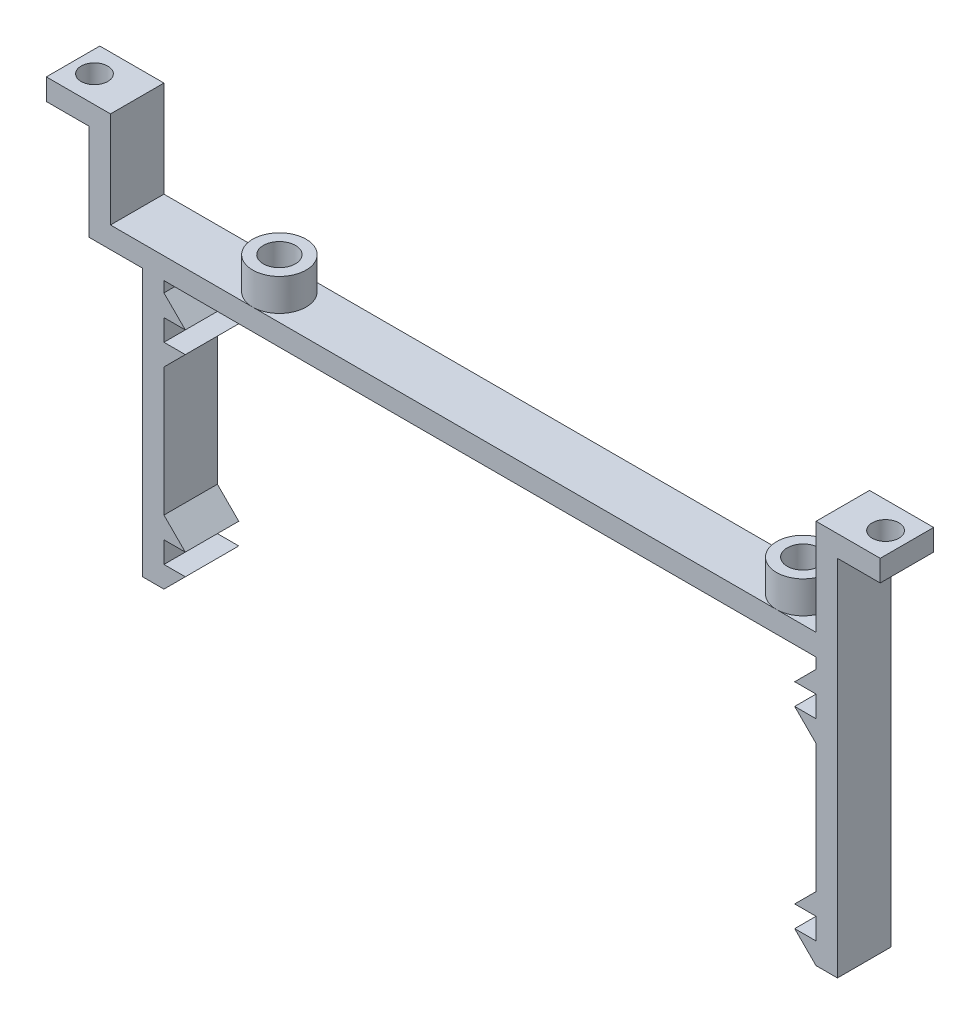
from build123d import *

# Parameters (mm, degrees)
SKETCH1_W           = 66
SKETCH1_H           = 5
BASE_FLANGE1_DEPTH  = 2
SKETCH2_R           = 2.5
BOSS_EXTRUDE1_DEPTH = 3
SKETCH3_W           = 2
SKETCH3_H           = 5
BOSS_EXTRUDE2_DEPTH = 11
SKETCH4_W           = 6
SKETCH4_H           = 5
BOSS_EXTRUDE3_DEPTH = 2
SKETCH5_R           = 1.5
CUT_EXTRUDE1_DEPTH  = 40.537956447
SKETCH6_R           = 1.25
CUT_EXTRUDE2_DEPTH  = 41.598645298
SKETCH7_W           = 2
SKETCH7_H           = 5
BOSS_EXTRUDE4_DEPTH = 25
BOSS_EXTRUDE5_DEPTH = 5


# Sheet-metal steps are written as plain solids
with BuildPart() as part:
    # Sketch1 → Base-Flange1 (new body)
    with BuildSketch(Plane(origin=(0, 0, 0), x_dir=(1, 0, 0), z_dir=(0, 1, 0))):
        Rectangle(SKETCH1_W, SKETCH1_H)
    extrude(amount=-BASE_FLANGE1_DEPTH)

    # Sketch2 → Boss-Extrude1 (add)
    with BuildSketch(Plane(origin=(0, 0, 0), x_dir=(-1, 0, 0), z_dir=(0, -1, 0))):
        with Locations(Location((19.7, 0, 0), (0, 0, 90))):
            Circle(SKETCH2_R)
        with Locations(Location((-29.3, 0, 0), (0, 0, 90))):
            Circle(SKETCH2_R)
    extrude(amount=-BOSS_EXTRUDE1_DEPTH)

    # Sketch3 → Boss-Extrude2 (add)
    with BuildSketch(Plane(origin=(0, -2, 0), x_dir=(-1, 0, 0), z_dir=(0, -1, 0))):
        with Locations((-34, 0)):
            Rectangle(SKETCH3_W, SKETCH3_H)
    boss_extrude2 = extrude(amount=-BOSS_EXTRUDE2_DEPTH)

    # Sketch4 → Boss-Extrude3 (add)
    with BuildSketch(Plane(origin=(0, 9, 0), x_dir=(1, 0, 0), z_dir=(0, 1, 0))):
        with Locations((36, 0)):
            Rectangle(SKETCH4_W, SKETCH4_H)
    boss_extrude3 = extrude(amount=-BOSS_EXTRUDE3_DEPTH)

    # Mirror1: Boss-Extrude2, Boss-Extrude3 across plane
    add(boss_extrude2.mirror(Plane(origin=(0, 0, 0), x_dir=(0, 0, 1), z_dir=(1, 0, 0))))
    add(boss_extrude3.mirror(Plane(origin=(0, 0, 0), x_dir=(0, 0, 1), z_dir=(1, 0, 0))))

    # Sketch5 → Cut-Extrude1 (cut, through all)
    with BuildSketch(Plane(origin=(0, 3, 0), x_dir=(1, 0, 0), z_dir=(0, 1, 0))):
        with Locations(Location((-19.7, 0, 0), (0, 0, 270))):
            Circle(SKETCH5_R)
        with Locations(Location((29.3, 0, 0), (0, 0, 270))):
            Circle(SKETCH5_R)
    extrude(amount=-CUT_EXTRUDE1_DEPTH, mode=Mode.SUBTRACT)

    # Sketch6 → Cut-Extrude2 (cut, through all)
    with BuildSketch(Plane(origin=(0, 9, 0), x_dir=(1, 0, 0), z_dir=(0, 1, 0))):
        with Locations(Location((-37, 0, 0), (0, 0, 270))):
            Circle(SKETCH6_R)
        with Locations(Location((37, 0, 0), (0, 0, 270))):
            Circle(SKETCH6_R)
    extrude(amount=-CUT_EXTRUDE2_DEPTH, mode=Mode.SUBTRACT)

    # Sketch7 → Boss-Extrude4 (add)
    with BuildSketch(Plane(origin=(0, -2, 0), x_dir=(-1, 0, 0), z_dir=(0, -1, 0))):
        with Locations((29, 0)):
            Rectangle(SKETCH7_W, SKETCH7_H)
    boss_extrude4 = extrude(amount=BOSS_EXTRUDE4_DEPTH)

    # Sketch8 → Boss-Extrude5 (add)
    with BuildSketch(Plane.XY.offset(2.5)):
        Polygon((-28, -3), (-26, -5), (-28, -5), align=None)
        Polygon((-28, -7), (-26, -7), (-28, -9), align=None)
        Polygon((-28, -21), (-28, -23), (-26, -23), align=None)
        Polygon((-28, -25), (-28, -27), (-26, -25), align=None)
    boss_extrude5 = extrude(amount=-BOSS_EXTRUDE5_DEPTH)

    # Mirror2: Boss-Extrude4, Boss-Extrude5 across plane
    add(boss_extrude4.mirror(Plane(origin=(2.5, 0, 0), x_dir=(0, 0, 1), z_dir=(1, 0, 0))))
    add(boss_extrude5.mirror(Plane(origin=(2.5, 0, 0), x_dir=(0, 0, 1), z_dir=(1, 0, 0))))


solid = part.part
